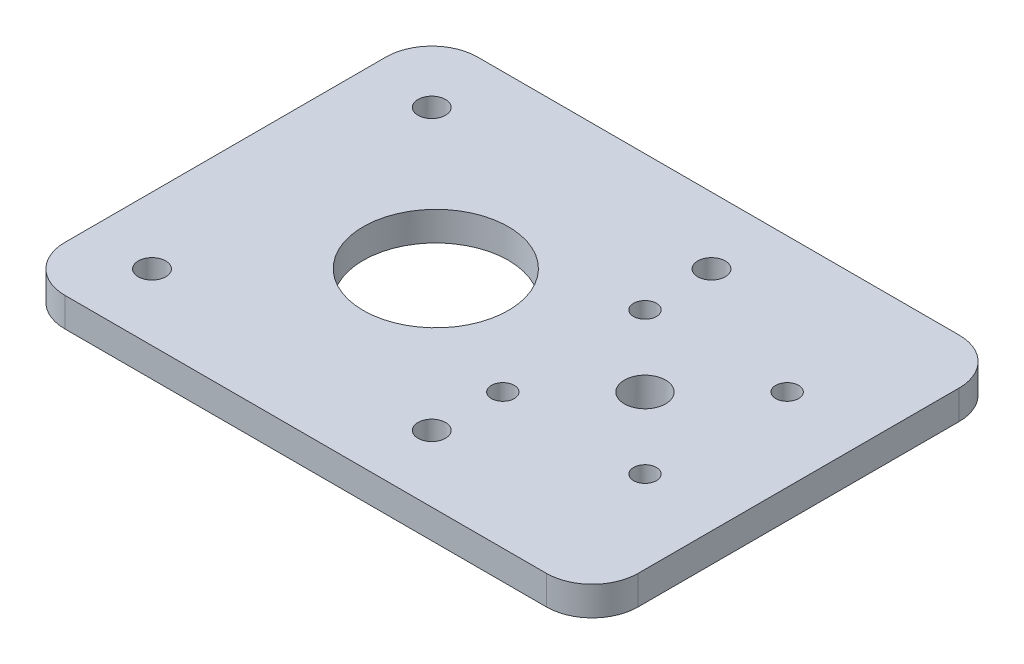
from build123d import *

# Parameters (mm, degrees)
BOSS_EXTRUDE1_OUTLINE_W = 125
BOSS_EXTRUDE1_OUTLINE_H = 90
BOSS_EXTRUDE1_DEPTH     = 6.35
SKETCH2_R               = 3
CUT_EXTRUDE1_DEPTH      = 10
SKETCH3_R               = 4.5
SKETCH3_R_2             = 2.5
SERVO_CUTOUT_DEPTH      = 10
FILLET1_R               = 10
SKETCH4_R               = 15.825603453
CUT_EXTRUDE3_DEPTH      = 10


# Read off the part's stored shape, not the designer's step: Boss-Extrude1
with BuildPart() as part:
    # Boss-Extrude1 outline → Boss-Extrude1 (new body)
    with BuildSketch(Plane(origin=(0, 0, 0), x_dir=(1, 0, 0), z_dir=(0, 1, 0))):
        with Locations((62.5, 45)):
            Rectangle(BOSS_EXTRUDE1_OUTLINE_W, BOSS_EXTRUDE1_OUTLINE_H)
    extrude(amount=BOSS_EXTRUDE1_DEPTH)

    # Sketch2 → Cut-Extrude1 (cut)
    with BuildSketch(Plane(origin=(0, 6.35, 0), x_dir=(1, 0, 0), z_dir=(0, 1, 0))):
        with Locations(Location((14.5, 14.5, 0), (0, 0, 270))):
            Circle(SKETCH2_R)
        with Locations(Location((75.5, 14.5, 0), (0, 0, 270))):
            Circle(SKETCH2_R)
        with Locations(Location((75.5, 75.5, 0), (0, 0, 270))):
            Circle(SKETCH2_R)
        with Locations(Location((14.5, 75.5, 0), (0, 0, 270))):
            Circle(SKETCH2_R)
    extrude(amount=-CUT_EXTRUDE1_DEPTH, mode=Mode.SUBTRACT)

    # Sketch3 → Servo_Cutout (cut)
    with BuildSketch(Plane(origin=(0, 6.35, 0), x_dir=(1, 0, 0), z_dir=(0, 1, 0))):
        with Locations(Location((91.5, 45, 0), (0, 0, 270))):
            Circle(SKETCH3_R)
        with Locations(Location((107, 60.5, 0), (0, 0, 270))):
            Circle(SKETCH3_R_2)
        with Locations(Location((76, 60.5, 0), (0, 0, 270))):
            Circle(SKETCH3_R_2)
        with Locations(Location((76, 29.5, 0), (0, 0, 270))):
            Circle(SKETCH3_R_2)
        with Locations(Location((107, 29.5, 0), (0, 0, 270))):
            Circle(SKETCH3_R_2)
    extrude(amount=-SERVO_CUTOUT_DEPTH, mode=Mode.SUBTRACT)

    # Fillet1
    fillet1_edges = [part.edges().sort_by_distance(p)[0] for p in [
        (0, 3.175, -90),
        (125, 3.175, -90),
        (125, 3.175, 0),
        (0, 3.175, 0),
    ]]
    fillet(fillet1_edges, radius=FILLET1_R)

    # Sketch4 → Cut-Extrude3 (cut)
    with BuildSketch(Plane(origin=(0, 6.35, 0), x_dir=(1, 0, 0), z_dir=(0, 1, 0))):
        with Locations(Location((45.38988598, 45.496671395, 0), (0, 0, 270))):
            Circle(SKETCH4_R)
    extrude(amount=-CUT_EXTRUDE3_DEPTH, mode=Mode.SUBTRACT)


solid = part.part
